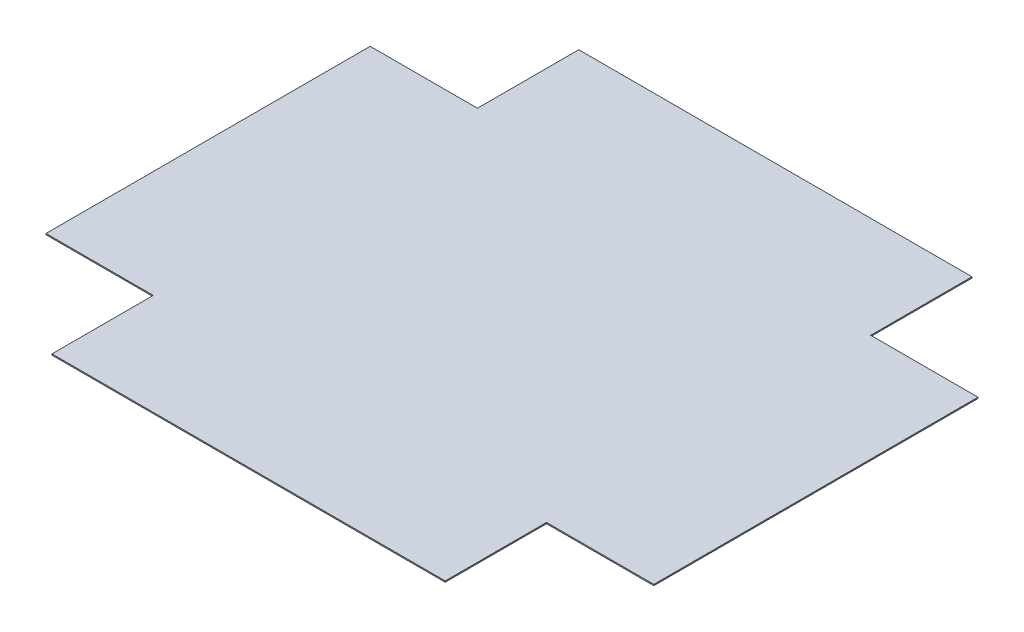
from build123d import *

# Parameters (mm, degrees)
BASE_FLANGE1_DEPTH = 0.7366


# Sheet-metal steps are written as plain solids
with BuildPart() as part:
    # Sketch1 → Base-Flange1 (new body)
    with BuildSketch(Plane(origin=(0, 0, 0), x_dir=(1, 0, 0), z_dir=(0, 1, 0))):
        Polygon((-127, 101.6), (-123.25, 101.6), (-123.25, 165.1), (123.25, 165.1), (123.25, 101.6), (127, 101.6), (190.5, 101.6), (190.5, -101.6), (127, -101.6), (123.25, -101.6), (123.25, -165.1), (-123.25, -165.1), (-123.25, -101.6), (-127, -101.6), (-190.5, -101.6), (-190.5, 101.6), align=None)
    extrude(amount=-BASE_FLANGE1_DEPTH)


solid = part.part
